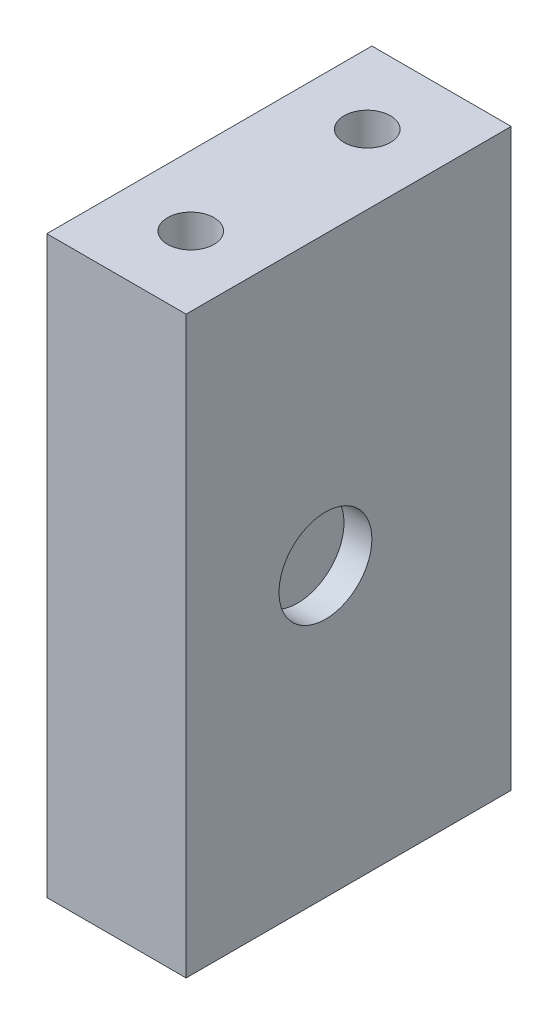
from build123d import *

# Parameters (mm, degrees)
SKETCH1_W           = 15
SKETCH1_H           = 35
SKETCH1_R           = 2.5
BOSS_EXTRUDE1_DEPTH = 30.95
SKETCH2_R           = 5
CUT_EXTRUDE1_DEPTH  = 3


with BuildPart() as part:
    # Sketch1 → Boss-Extrude1 (new, symmetric)
    with BuildSketch(Plane(origin=(0, 0, 0), x_dir=(1, 0, 0), z_dir=(0, 1, 0))):
        Rectangle(SKETCH1_W, SKETCH1_H)
        with Locations((0, 9.5)):
            Circle(SKETCH1_R, mode=Mode.SUBTRACT)
        with Locations((0, -9.5)):
            Circle(SKETCH1_R, mode=Mode.SUBTRACT)
    extrude(amount=BOSS_EXTRUDE1_DEPTH, both=True)

    # Sketch2 → Cut-Extrude1 (cut)
    with BuildSketch(Plane(origin=(7.5, 0, 0), x_dir=(0, 0, -1), z_dir=(1, 0, 0))):
        with Locations((-2.5, 0)):
            Circle(SKETCH2_R)
    extrude(amount=-CUT_EXTRUDE1_DEPTH, mode=Mode.SUBTRACT)


solid = part.part
